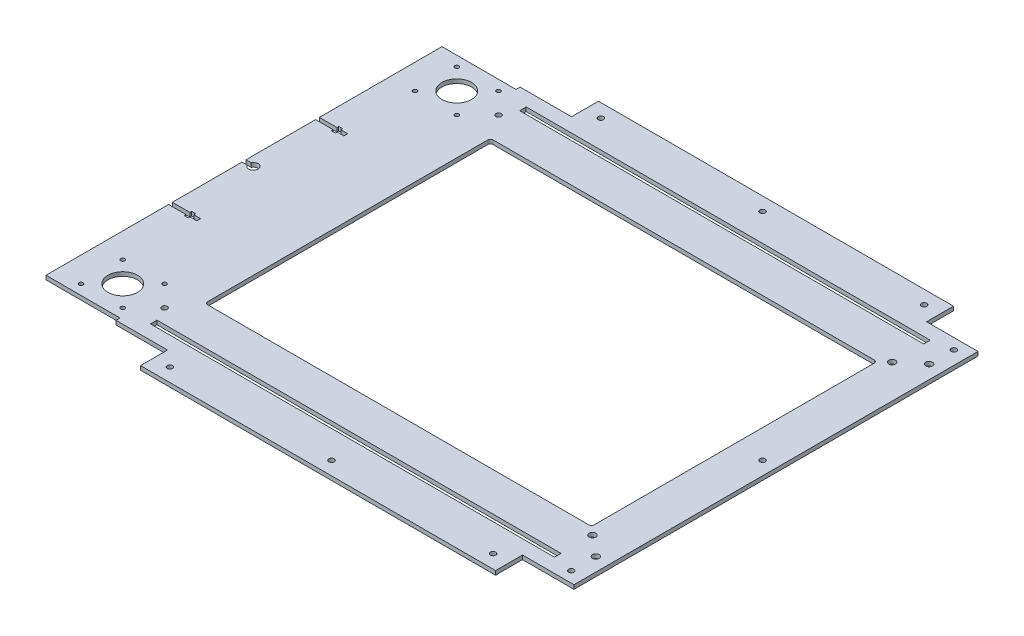
from build123d import *

# Parameters (mm, degrees)
SKETCH1_W           = 300
SKETCH1_H           = 4.85
SKETCH1_R           = 2
SKETCH1_R_2         = 2.5
SKETCH1_R_3         = 1.5
SKETCH1_R_4         = 11
BOSS_EXTRUDE1_DEPTH = 3


with BuildPart() as part:
    # Sketch1 → Boss-Extrude1 (new body)
    with BuildSketch(Plane(origin=(0, 0, 0), x_dir=(1, 0, 0), z_dir=(0, 1, 0))):
        with BuildLine():
            Line((170, -150), (170, 150))
            Line((170, 150), (131.8, 150))
            Line((131.8, 150), (131.8, 170))
            Line((131.8, 170), (-131.8, 170))
            Line((-131.8, 170), (-131.8, 150))
            Line((-131.8, 150), (-170, 150))
            Line((-170, 150), (-170, 147))
            Line((-170, 147), (-225, 147))
            Line((-225, 147), (-225, 56))
            Line((-225, 56), (-212, 56))
            Line((-212, 56), (-212, 57.35))
            Line((-212, 57.35), (-209, 57.35))
            Line((-209, 57.35), (-209, 56))
            Line((-209, 56), (-204, 56))
            Line((-204, 56), (-204, 53.2))
            Line((-204, 53.2), (-209, 53.2))
            Line((-209, 53.2), (-209, 51.85))
            Line((-209, 51.85), (-212, 51.85))
            Line((-212, 51.85), (-212, 53.2))
            Line((-212, 53.2), (-225, 53.2))
            Line((-225, 53.2), (-225, 1.5))
            Line((-225, 1.5), (-221.16227766, 1.5))
            ThreePointArc((-221.16227766, 1.5), (-214.5, 0), (-221.16227766, -1.5))
            Line((-221.16227766, -1.5), (-225, -1.5))
            Line((-225, -1.5), (-225, -53.2))
            Line((-225, -53.2), (-212, -53.2))
            Line((-212, -53.2), (-212, -51.85))
            Line((-212, -51.85), (-209, -51.85))
            Line((-209, -51.85), (-209, -53.2))
            Line((-209, -53.2), (-204, -53.2))
            Line((-204, -53.2), (-204, -56))
            Line((-204, -56), (-209, -56))
            Line((-209, -56), (-209, -57.35))
            Line((-209, -57.35), (-212, -57.35))
            Line((-212, -57.35), (-212, -56))
            Line((-212, -56), (-225, -56))
            Line((-225, -56), (-225, -147))
            Line((-225, -147), (-170, -147))
            Line((-170, -147), (-170, -150))
            Line((-170, -150), (-131.8, -150))
            Line((-131.8, -150), (-131.8, -170))
            Line((-131.8, -170), (131.8, -170))
            Line((131.8, -170), (131.8, -150))
            Line((131.8, -150), (170, -150))
        make_face()
        with Locations((-4.945467554, -137.075)):
            Rectangle(SKETCH1_W, SKETCH1_H, mode=Mode.SUBTRACT)
        with BuildLine():
            Line((139, 104), (139, -104))
            ThreePointArc((139, -104), (138.414213562, -105.414213562), (137, -106))
            Line((137, -106), (-146, -106))
            ThreePointArc((-146, -106), (-147.414213562, -105.414213562), (-148, -104))
            Line((-148, -104), (-148, 104))
            ThreePointArc((-148, 104), (-147.414213562, 105.414213562), (-146, 106))
            Line((-146, 106), (137, 106))
            ThreePointArc((137, 106), (138.414213562, 105.414213562), (139, 104))
        make_face(mode=Mode.SUBTRACT)
        with Locations((-4.945467554, 137.075)):
            Rectangle(SKETCH1_W, SKETCH1_H, mode=Mode.SUBTRACT)
        with Locations((160, -142)):
            Circle(SKETCH1_R, mode=Mode.SUBTRACT)
        with Locations((160, -123.75)):
            Circle(SKETCH1_R_2, mode=Mode.SUBTRACT)
        with Locations((145, -111.25)):
            Circle(SKETCH1_R_2, mode=Mode.SUBTRACT)
        with Locations((160, 0)):
            Circle(SKETCH1_R, mode=Mode.SUBTRACT)
        with Locations((145, 111.25)):
            Circle(SKETCH1_R_2, mode=Mode.SUBTRACT)
        with Locations((160, 123.75)):
            Circle(SKETCH1_R_2, mode=Mode.SUBTRACT)
        with Locations((160, 142)):
            Circle(SKETCH1_R, mode=Mode.SUBTRACT)
        with Locations((-160, -124)):
            Circle(SKETCH1_R, mode=Mode.SUBTRACT)
        with Locations((-160, 124)):
            Circle(SKETCH1_R, mode=Mode.SUBTRACT)
        with Locations((0, -160)):
            Circle(SKETCH1_R, mode=Mode.SUBTRACT)
        with Locations((120, -160)):
            Circle(SKETCH1_R, mode=Mode.SUBTRACT)
        with Locations((-120, -160)):
            Circle(SKETCH1_R, mode=Mode.SUBTRACT)
        with Locations((120, 160)):
            Circle(SKETCH1_R, mode=Mode.SUBTRACT)
        with Locations((0, 160)):
            Circle(SKETCH1_R, mode=Mode.SUBTRACT)
        with Locations((-120, 160)):
            Circle(SKETCH1_R, mode=Mode.SUBTRACT)
        with Locations((-175.5, -108.5)):
            Circle(SKETCH1_R_3, mode=Mode.SUBTRACT)
        with Locations((-206.5, -139.5)):
            Circle(SKETCH1_R_3, mode=Mode.SUBTRACT)
        with Locations((-175.5, -139.5)):
            Circle(SKETCH1_R_3, mode=Mode.SUBTRACT)
        with Locations((-191, -124)):
            Circle(SKETCH1_R_4, mode=Mode.SUBTRACT)
        with Locations((-206.5, -108.5)):
            Circle(SKETCH1_R_3, mode=Mode.SUBTRACT)
        with Locations((-175.5, 139.5)):
            Circle(SKETCH1_R_3, mode=Mode.SUBTRACT)
        with Locations((-206.5, 139.5)):
            Circle(SKETCH1_R_3, mode=Mode.SUBTRACT)
        with Locations((-206.5, 108.5)):
            Circle(SKETCH1_R_3, mode=Mode.SUBTRACT)
        with Locations((-191, 124)):
            Circle(SKETCH1_R_4, mode=Mode.SUBTRACT)
        with Locations((-175.5, 108.5)):
            Circle(SKETCH1_R_3, mode=Mode.SUBTRACT)
    extrude(amount=BOSS_EXTRUDE1_DEPTH)


solid = part.part
